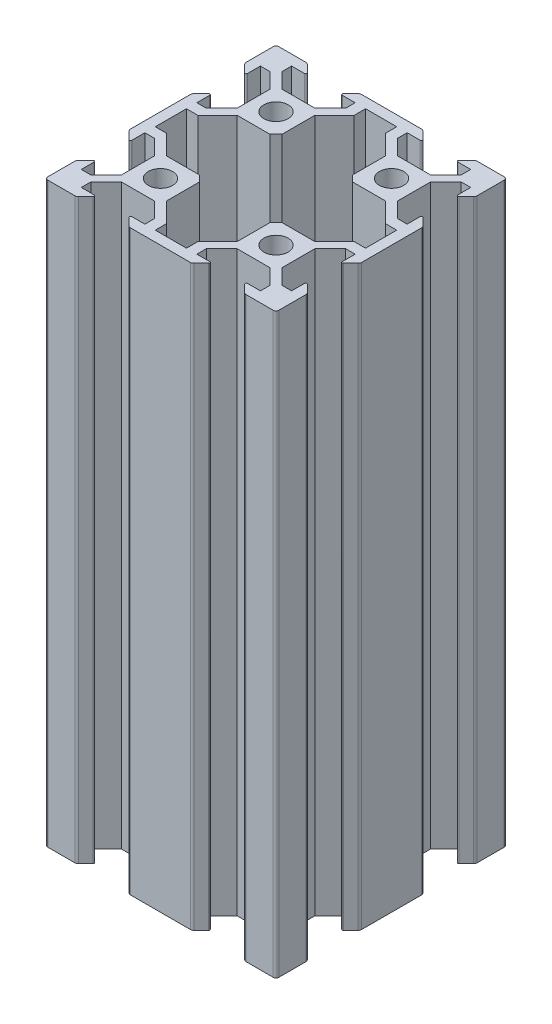
from build123d import *

# Parameters (mm, degrees)
SKETCH1_R           = 2
BOSS_EXTRUDE1_DEPTH = 50
CIRPATTERN1_COUNT   = 4


# Read off the part's stored shape, not the designer's step: M5 Tapped Hole1
with BuildPart() as part:
    # Sketch1 → Boss-Extrude1 (new, symmetric)
    with BuildSketch(Plane(origin=(0, 0, 0), x_dir=(1, 0, 0), z_dir=(0, 1, 0))):
        with BuildLine():
            Line((-16.239339828, 2.7), (-18.2, 2.7))
            Line((-18.2, 2.7), (-18.2, 0))
            Line((-18.2, 0), (-20, 0))
            Line((-20, 0), (-20, 5.168552829))
            ThreePointArc((-20, 5.168552829), (-19.953791286, 5.400859724), (-19.8222, 5.5978))
            Line((-19.8222, 5.5978), (-18.541421356, 6.878578644))
            ThreePointArc((-18.541421356, 6.878578644), (-18.323463314, 6.921933194), (-18.2, 6.737157288))
            Line((-18.2, 6.737157288), (-18.2, 4.5))
            Line((-18.2, 4.5), (-16.560660172, 4.5))
            Line((-16.560660172, 4.5), (-13.9, 7.160660172))
            Line((-13.9, 7.160660172), (-13.9, 12.839339828))
            Line((-13.9, 12.839339828), (-16.560660172, 15.5))
            Line((-16.560660172, 15.5), (-18.2, 15.5))
            Line((-18.2, 15.5), (-18.2, 13.262842712))
            ThreePointArc((-18.2, 13.262842712), (-18.323463314, 13.078066806), (-18.541421356, 13.121421356))
            Line((-18.541421356, 13.121421356), (-19.8222, 14.4022))
            ThreePointArc((-19.8222, 14.4022), (-19.953791286, 14.599140276), (-20, 14.831447171))
            Line((-20, 14.831447171), (-20, 19.5))
            ThreePointArc((-20, 19.5), (-19.853553391, 19.853553391), (-19.5, 20))
            Line((-19.5, 20), (-14.831447171, 20))
            ThreePointArc((-14.831447171, 20), (-14.599140276, 19.953791286), (-14.4022, 19.8222))
            Line((-14.4022, 19.8222), (-13.121421356, 18.541421356))
            ThreePointArc((-13.121421356, 18.541421356), (-13.078066806, 18.323463314), (-13.262842712, 18.2))
            Line((-13.262842712, 18.2), (-15.5, 18.2))
            Line((-15.5, 18.2), (-15.5, 16.560660172))
            Line((-15.5, 16.560660172), (-12.839339828, 13.9))
            Line((-12.839339828, 13.9), (-7.160660172, 13.9))
            Line((-7.160660172, 13.9), (-4.5, 16.560660172))
            Line((-4.5, 16.560660172), (-4.5, 18.2))
            Line((-4.5, 18.2), (-6.737157288, 18.2))
            ThreePointArc((-6.737157288, 18.2), (-6.921933194, 18.323463314), (-6.878578644, 18.541421356))
            Line((-6.878578644, 18.541421356), (-5.5978, 19.8222))
            ThreePointArc((-5.5978, 19.8222), (-5.400859724, 19.953791286), (-5.168552829, 20))
            Line((-5.168552829, 20), (0, 20))
            Line((0, 20), (0, 18.2))
            Line((0, 18.2), (-2.7, 18.2))
            Line((-2.7, 18.2), (-2.7, 16.239339828))
            Line((-2.7, 16.239339828), (-6.1, 12.839339828))
            Line((-6.1, 12.839339828), (-6.1, 7.160660172))
            Line((-6.1, 7.160660172), (-7.160660172, 6.1))
            Line((-7.160660172, 6.1), (-12.839339828, 6.1))
            Line((-12.839339828, 6.1), (-16.239339828, 2.7))
        make_face()
        with Locations(Location((-10, 10, 0), (0, 0, 270))):
            Circle(SKETCH1_R, mode=Mode.SUBTRACT)
    boss_extrude1 = extrude(amount=BOSS_EXTRUDE1_DEPTH, both=True)

    # CirPattern1: Boss-Extrude1 ×4 about axis
    cirpattern1_axis = Axis((0, 0, 0), (0, 1, 0))
    for i in range(1, CIRPATTERN1_COUNT):
        add(boss_extrude1.rotate(cirpattern1_axis, i * 360 / CIRPATTERN1_COUNT))

    # M5 Tapped Hole1 outline → M5 Tapped Hole1 (revolve, cut)
    with BuildSketch(Plane(origin=(10, 0, 10), x_dir=(1, 0, 0), z_dir=(0, 0, 1))):
        Polygon((2.1, -37.6), (2, -37.539913938), (2, -50), (2.1, -50), align=None)
        Polygon((2, 50), (2, 37.539913938), (2.1, 37.6), (2.1, 50), align=None)
    revolve(axis=Axis((10, 0, 10), (0, 1, 0)), mode=Mode.SUBTRACT)

    # M5 Tapped Hole1 2 outline → M5 Tapped Hole1 2 (revolve, cut)
    with BuildSketch(Plane(origin=(10, 0, -10), x_dir=(1, 0, 0), z_dir=(0, 0, 1))):
        Polygon((2.1, -37.6), (2, -37.539913938), (2, -50), (2.1, -50), align=None)
        Polygon((2, 50), (2, 37.539913938), (2.1, 37.6), (2.1, 50), align=None)
    revolve(axis=Axis((10, 0, -10), (0, 1, 0)), mode=Mode.SUBTRACT)

    # M5 Tapped Hole1 3 outline → M5 Tapped Hole1 3 (revolve, cut)
    with BuildSketch(Plane(origin=(-10, 0, 10), x_dir=(1, 0, 0), z_dir=(0, 0, 1))):
        Polygon((2.1, -37.6), (2, -37.539913938), (2, -50), (2.1, -50), align=None)
        Polygon((2, 50), (2, 37.539913938), (2.1, 37.6), (2.1, 50), align=None)
    revolve(axis=Axis((-10, 0, 10), (0, 1, 0)), mode=Mode.SUBTRACT)

    # M5 Tapped Hole1 4 outline → M5 Tapped Hole1 4 (revolve, cut)
    with BuildSketch(Plane(origin=(-10, 0, -10), x_dir=(1, 0, 0), z_dir=(0, 0, 1))):
        Polygon((2.1, -37.6), (2, -37.539913938), (2, -50), (2.1, -50), align=None)
        Polygon((2, 50), (2, 37.539913938), (2.1, 37.6), (2.1, 50), align=None)
    revolve(axis=Axis((-10, 0, -10), (0, 1, 0)), mode=Mode.SUBTRACT)


solid = part.part
